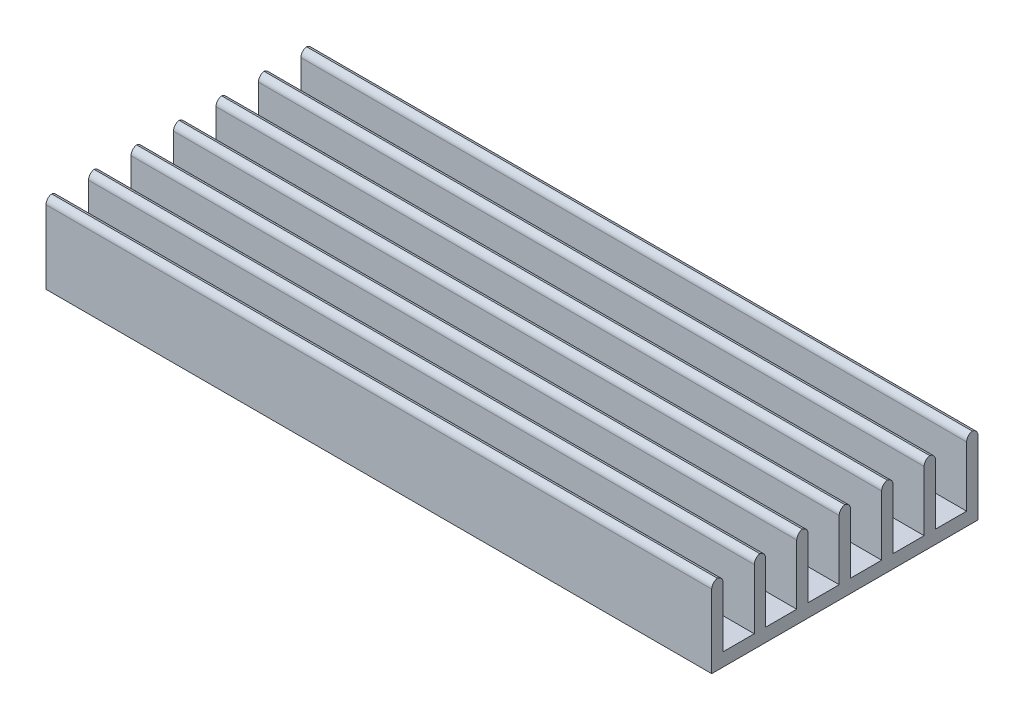
from build123d import *

# Parameters (mm, degrees)
SKETCH_1_W          = 50
SKETCH_1_H          = 20
EXTRUDE_1_DEPTH     = 6
SKETCH_2_W          = 50
SKETCH_2_H          = 2.34
CUT_EXTRUDE_1_DEPTH = 5
FILLET_1_R          = 0.5


with BuildPart() as part:
    # 草图1 → 凸台-拉伸1 (new body)
    with BuildSketch(Plane(origin=(0, 0, 0), x_dir=(1, 0, 0), z_dir=(0, 1, 0))):
        Rectangle(SKETCH_1_W, SKETCH_1_H)
    extrude(amount=EXTRUDE_1_DEPTH)

    # 草图2 → 切除-拉伸1 (cut)
    with BuildSketch(Plane(origin=(0, 6, 0), x_dir=(1, 0, 0), z_dir=(0, 1, 0))):
        with Locations((0, 1.595)):
            Rectangle(SKETCH_2_W, SKETCH_2_H)
        with Locations((0, -1.595)):
            Rectangle(SKETCH_2_W, SKETCH_2_H)
        with Locations((0, 4.785)):
            Rectangle(SKETCH_2_W, SKETCH_2_H)
        with Locations((0, -4.785)):
            Rectangle(SKETCH_2_W, SKETCH_2_H)
        with Locations((0, 7.975)):
            Rectangle(SKETCH_2_W, SKETCH_2_H)
        with Locations((0, -7.975)):
            Rectangle(SKETCH_2_W, SKETCH_2_H)
    extrude(amount=-CUT_EXTRUDE_1_DEPTH, mode=Mode.SUBTRACT)

    # 圆角1
    # the kernel refuses this fillet: 0.5 mm, written as the material it takes off along each edge
    with BuildSketch(Plane(origin=(26.25, 6, 10), x_dir=(0, 0, -1), z_dir=(-1, 0, 0)), Plane(origin=(26.25, 6, 6.805), x_dir=(0, 0, -1), z_dir=(-1, 0, 0)), Plane(origin=(26.25, 6, 3.615), x_dir=(0, 0, -1), z_dir=(-1, 0, 0)), Plane(origin=(26.25, 6, 0.425), x_dir=(0, 0, -1), z_dir=(-1, 0, 0)), Plane(origin=(26.25, 6, -2.765), x_dir=(0, 0, -1), z_dir=(-1, 0, 0)), Plane(origin=(26.25, 6, -5.955), x_dir=(0, 0, -1), z_dir=(-1, 0, 0)), Plane(origin=(26.25, 6, -9.145), x_dir=(0, 0, -1), z_dir=(-1, 0, 0))) as fillet_1_piece_1:
        with BuildLine():
            CenterArc((FILLET_1_R, FILLET_1_R), FILLET_1_R, 180, 90)
            Line((0, FILLET_1_R), (0, 0))
            Line((0, 0), (FILLET_1_R, 0))
        make_face()
    extrude(amount=52.5, mode=Mode.SUBTRACT)
    with BuildSketch(Plane(origin=(-26.25, 6, -10), x_dir=(0, -1, 0), z_dir=(1, 0, 0)), Plane(origin=(-26.25, 6, 9.145), x_dir=(0, -1, 0), z_dir=(1, 0, 0)), Plane(origin=(-26.25, 6, 5.955), x_dir=(0, -1, 0), z_dir=(1, 0, 0)), Plane(origin=(-26.25, 6, 2.765), x_dir=(0, -1, 0), z_dir=(1, 0, 0)), Plane(origin=(-26.25, 6, -0.425), x_dir=(0, -1, 0), z_dir=(1, 0, 0)), Plane(origin=(-26.25, 6, -3.615), x_dir=(0, -1, 0), z_dir=(1, 0, 0)), Plane(origin=(-26.25, 6, -6.805), x_dir=(0, -1, 0), z_dir=(1, 0, 0))) as fillet_1_piece_2:
        with BuildLine():
            CenterArc((FILLET_1_R, -FILLET_1_R), FILLET_1_R, 90, 90)
            Line((0, -FILLET_1_R), (0, 0))
            Line((0, 0), (FILLET_1_R, 0))
        make_face()
    extrude(amount=52.5, mode=Mode.SUBTRACT)


solid = part.part
